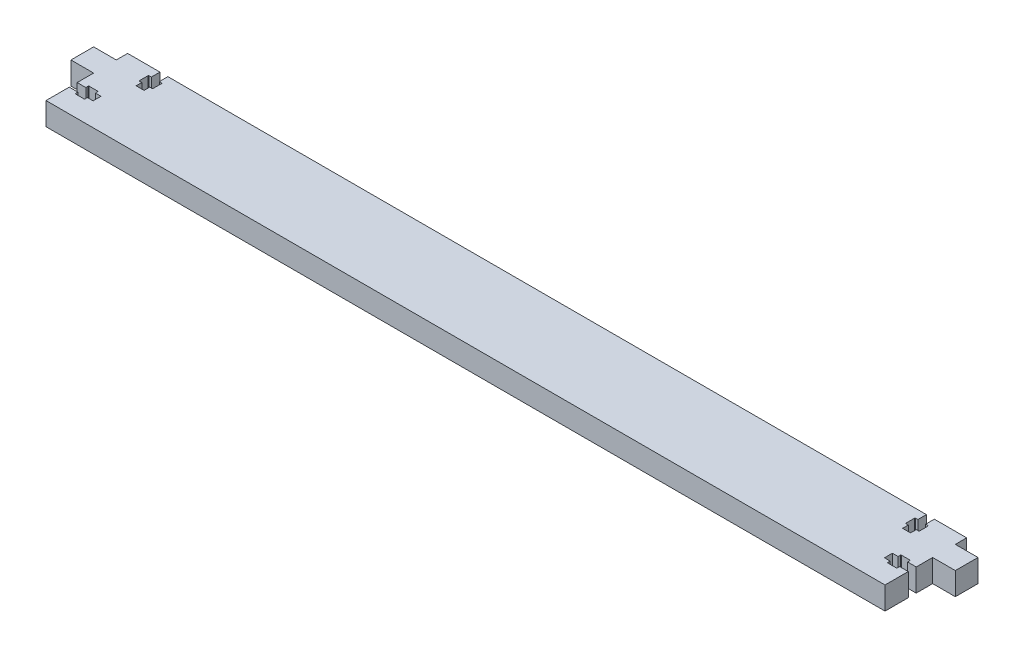
from build123d import *

# Parameters (mm, degrees)
MAINSHAPE_DEPTH  = 10
SCREWSLOTS_DEPTH = 197.084165602


with BuildPart() as part:
    # Sketch1 → MainShape (new body)
    with BuildSketch(Plane(origin=(0, 0, 0), x_dir=(1, 0, 0), z_dir=(0, 1, 0))):
        Polygon((0, 18), (-185, 18), (-185, 13), (-195, 13), (-195, 3), (-185, 3), (-185, -18), (0, -18), align=None)
    mainshape = extrude(amount=MAINSHAPE_DEPTH)

    # Sketch2 → ScrewSlots (cut, through all)
    with BuildSketch(Plane(origin=(0, 10, 0), x_dir=(1, 0, 0), z_dir=(0, 1, 0))):
        with BuildLine():
            Line((-170.75, 18), (-170.75, 14.2))
            Line((-170.75, 14.2), (-171.75, 14.2))
            ThreePointArc((-171.75, 14.2), (-171.926776695, 14.126776695), (-172, 13.95))
            Line((-172, 13.95), (-172, 10.25))
            ThreePointArc((-172, 10.25), (-171.926776695, 10.073223305), (-171.75, 10))
            Line((-171.75, 10), (-170.75, 10))
            Line((-170.75, 10), (-170.75, 7.5))
            Line((-170.75, 7.5), (-167.25, 7.5))
            Line((-167.25, 7.5), (-167.25, 10))
            Line((-167.25, 10), (-166.25, 10))
            ThreePointArc((-166.25, 10), (-166.073223305, 10.073223305), (-166, 10.25))
            Line((-166, 10.25), (-166, 13.95))
            ThreePointArc((-166, 13.95), (-166.073223305, 14.126776695), (-166.25, 14.2))
            Line((-166.25, 14.2), (-167.25, 14.2))
            Line((-167.25, 14.2), (-167.25, 18))
            Line((-167.25, 18), (-170.75, 18))
        make_face()
        with BuildLine():
            Line((-174.5, -7.75), (-174.5, -4.25))
            Line((-174.5, -4.25), (-177, -4.25))
            Line((-177, -4.25), (-177, -3.25))
            ThreePointArc((-177, -3.25), (-177.073223305, -3.073223305), (-177.25, -3))
            Line((-177.25, -3), (-180.95, -3))
            ThreePointArc((-180.95, -3), (-181.126776695, -3.073223305), (-181.2, -3.25))
            Line((-181.2, -3.25), (-181.2, -4.25))
            Line((-181.2, -4.25), (-185, -4.25))
            Line((-185, -4.25), (-185, -7.75))
            Line((-185, -7.75), (-181.2, -7.75))
            Line((-181.2, -7.75), (-181.2, -8.75))
            ThreePointArc((-181.2, -8.75), (-181.126776695, -8.926776695), (-180.95, -9))
            Line((-180.95, -9), (-177.25, -9))
            ThreePointArc((-177.25, -9), (-177.073223305, -8.926776695), (-177, -8.75))
            Line((-177, -8.75), (-177, -7.75))
            Line((-177, -7.75), (-174.5, -7.75))
        make_face()
    screwslots = extrude(amount=-SCREWSLOTS_DEPTH, mode=Mode.SUBTRACT)

    # Mirror1: MainShape, ScrewSlots across plane
    add(mainshape.mirror(Plane(origin=(0, 0, 0), x_dir=(0, 0, 1), z_dir=(1, 0, 0))))
    add(screwslots.mirror(Plane(origin=(0, 0, 0), x_dir=(0, 0, 1), z_dir=(1, 0, 0))), mode=Mode.SUBTRACT)


solid = part.part
